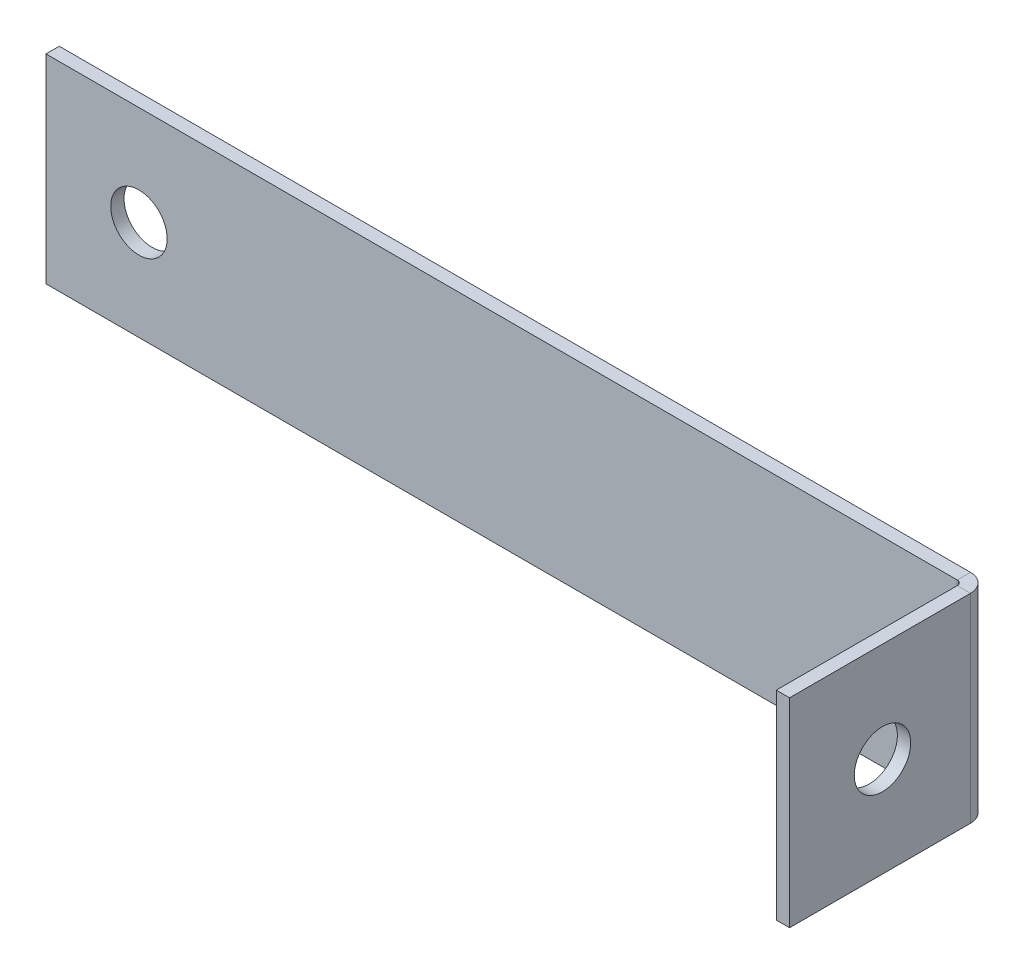
from build123d import *

# Parameters (mm, degrees)
SKETCH1_W                    = 140
SKETCH1_H                    = 30
SKETCH1_R                    = 4.25
BASE_FLANGE1_DEPTH           = 2
EDGE_FLANGE1_STRIP_W         = 9.4732
EDGE_FLANGE1_STRIP_H         = 2
EDGE_FLANGE1_STRIP_CUT_DEPTH = 30
EDGE_FLANGE1_DEPTH           = 30
SKETCH9_R                    = 4.25
CUT_EXTRUDE1_DEPTH           = 10


# Sheet-metal steps are written as plain solids
with BuildPart() as part:
    # Sketch1 → Base-Flange1 (new body)
    with BuildSketch(Plane.XY):
        with Locations((-9.240282686, 10.521201413)):
            Rectangle(SKETCH1_W, SKETCH1_H)
        with Locations((-65.240282686, 10.521201413)):
            Circle(SKETCH1_R, mode=Mode.SUBTRACT)
    extrude(amount=-BASE_FLANGE1_DEPTH)

    # Edge-Flange1 strip (across the edge) → Edge-Flange1 strip cut (cut)
    with BuildSketch(Plane(origin=(60.759717314, -4.478798587, 0), x_dir=(-1, 0, 0), z_dir=(0, 1, 0))):
        with Locations((-2, -1)):
            Rectangle(EDGE_FLANGE1_STRIP_W, EDGE_FLANGE1_STRIP_H)
    extrude(amount=EDGE_FLANGE1_STRIP_CUT_DEPTH, mode=Mode.SUBTRACT)

    # Edge-Flange1 section (across the edge) → Edge-Flange1 (add)
    with BuildSketch(Plane(origin=(60.759717314, -4.478798587, 0), x_dir=(-1, 0, 0), z_dir=(0, 1, 0))):
        with BuildLine():
            Line((0, 0.7366), (0, 28))
            Line((0, 28), (2, 28))
            Line((2, 28), (2, 0.7366))
            ThreePointArc((2, 0.7366), (2.215745145, 0.215745145), (2.7366, 0))
            Line((2.7366, 0), (2.7366, -2))
            ThreePointArc((2.7366, -2), (0.801531583, -1.198468417), (0, 0.7366))
        make_face()
    extrude(amount=EDGE_FLANGE1_DEPTH)

    # Sketch9 → Cut-Extrude1 (cut)
    with BuildSketch(Plane(origin=(60.759717314, 0, 0), x_dir=(0, 0, -1), z_dir=(1, 0, 0))):
        with Locations((-14, 10.521201413)):
            Circle(SKETCH9_R)
    extrude(amount=-CUT_EXTRUDE1_DEPTH, mode=Mode.SUBTRACT)


solid = part.part
